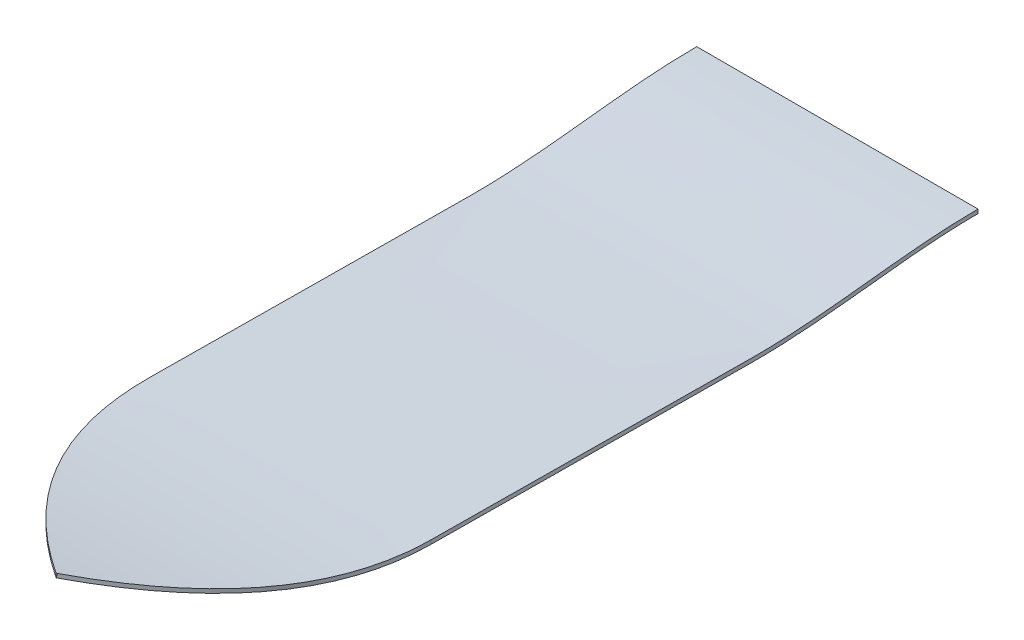
from build123d import *

# Parameters (mm, degrees)
BOSS_EXTRUDE1_DEPTH      = 1524
BOSS_EXTRUDE1_DEPTH_BACK = 1524
CUT_EXTRUDE1_DEPTH       = 2971.334706017
CUT_EXTRUDE1_DEPTH_BACK  = 2971.334706017
SKETCH3_W                = 5731.45735109
SKETCH3_H                = 7343.9774621


with BuildPart() as part:
    # Sketch1 → Boss-Extrude1 (new, two sides: drawn at the far end of the back side and taken through both)
    with BuildSketch(Plane(origin=(0, 0, 0), x_dir=(0, 0, -1), z_dir=(1, 0, 0)).offset(-BOSS_EXTRUDE1_DEPTH_BACK)):
        with BuildLine():
            Line((-2543.983620891, 91.500570068), (-2547.928552887, 66.408788315))
            add(Edge.make_bspline(
                [(-2547.928552887, 66.408788315), (-2542.105684338, 65.493316442), (-2530.46631391, 63.676489066), (-2507.112577211, 60.083503089), (-2477.826048238, 55.675793735), (-2442.516726356, 50.517885926), (-2395.222130959, 43.816594485), (-2335.697444714, 35.769425786), (-2263.618234042, 26.639961703), (-2190.889209569, 18.037515907), (-2093.050791937, 7.270175081), (-1969.128182432, -4.871860435), (-1817.821496687, -17.335536668), (-1663.914846889, -27.692955364), (-1507.408429898, -35.944994341), (-1374.818232478, -41.066683579), (-1267.448528406, -44.113566075), (-1186.263962878, -45.868068288), (-1118.091308787, -46.906724557), (-1063.174332439, -47.440708029), (-1008.358706053, -47.932840303), (-939.802208331, -48.565603467), (-830.132156253, -49.567925143), (-693.037131286, -50.823892641), (-528.525832615, -52.329314041), (-364.013775929, -53.835150797), (-199.501939719, -55.340892605), (-34.990042365, -56.846659346), (129.521840685, -58.352416097), (294.033723774, -59.858171071), (458.545614851, -61.363938356), (595.63886235, -62.618744472), (705.313664164, -63.62295068), (787.570168186, -64.37625734), (856.116870754, -65.003920803), (910.954206669, -65.504801547), (945.226222852, -65.819040387), (969.218546989, -66.035780436), (982.921278871, -66.165679202), (996.724364691, -66.274488824), (1013.862181684, -66.336294882), (1041.169862836, -66.300266795), (1075.035296353, -65.998438619), (1128.694009016, -65.000777719), (1194.815870346, -62.841500309), (1272.789633687, -58.966755677), (1349.536899656, -53.983476183), (1450.427706366, -46.094404041), (1574.211953424, -34.336590519), (1720.214259372, -18.588585689), (1864.875844249, -2.590206527), (1985.316604958, 9.801057862), (2082.212504816, 18.464705862), (2155.309626953, 24.167335273), (2228.986179203, 28.904666927), (2290.994880468, 31.906447902), (2341.047381855, 33.655381718), (2378.827009026, 34.619613478), (2410.533440068, 35.115891624), (2436.026851529, 35.317945116), (2448.844419205, 35.352211204), (2455.244379109, 35.352211204)],
                knots=[0, 0, 0, 0, 0.00390625, 0.0078125, 0.015625, 0.0234375, 0.03125, 0.046875, 0.0625, 0.078125, 0.09375, 0.125, 0.15625, 0.1875, 0.21875, 0.25, 0.265625, 0.28125, 0.296875, 0.3046875, 0.3125, 0.328125, 0.34375, 0.375, 0.40625, 0.4375, 0.46875, 0.5, 0.53125, 0.5625, 0.59375, 0.625, 0.640625, 0.65625, 0.671875, 0.6796875, 0.6875, 0.69140625, 0.693359375, 0.6953125, 0.69921875, 0.703125, 0.7109375, 0.71875, 0.734375, 0.75, 0.765625, 0.78125, 0.8125, 0.84375, 0.875, 0.90625, 0.921875, 0.9375, 0.953125, 0.96875, 0.9765625, 0.984375, 0.9921875, 0.99609375, 1, 1, 1, 1], degree=3))
            Line((2455.244379109, 35.352211204), (2455.244379109, 60.752211204))
            add(Edge.make_bspline(
                [(-2543.983620891, 91.500570068), (-2312.035580769, 55.033680082), (-1972.073883028, 16.227654851), (-1494.655069529, -12.393640456), (-1247.390010346, -19.826032299), (-1100.639201875, -21.676942451), (-1073.239826601, -21.943396342), (-1052.673202444, -22.129495205), (-953.281518673, -23.039959986), (-775.061118852, -24.671851119), (-500.874569462, -27.181392544), (-199.269457953, -29.941962734), (129.754315637, -32.953481324), (431.359432405, -35.71403098), (705.545955512, -38.223675062), (878.627736523, -39.809427698), (972.876611233, -40.6693717), (986.587550391, -40.796468465), (1005.396014769, -40.9270339), (1088.693400392, -41.02208833), (1233.800754896, -36.72664045), (1715.239092527, -3.018390136), (2093.620176364, 60.752211204), (2455.244379109, 60.752211204)],
                knots=[0, 0, 0, 0, 0.15625, 0.21875, 0.2890625, 0.30078125, 0.302734375, 0.3046875, 0.3125, 0.359375, 0.40625, 0.46875, 0.53125, 0.59375, 0.640625, 0.6875, 0.692382812, 0.694335938, 0.6953125, 0.703125, 0.7421875, 0.78125, 1, 1, 1, 1], degree=3))
        make_face()
    extrude(amount=BOSS_EXTRUDE1_DEPTH + BOSS_EXTRUDE1_DEPTH_BACK)

    # Sketch3 → Cut-Extrude1 (cut, two sides: drawn at the far end of the back side and taken through both)
    with BuildSketch(Plane(origin=(0, 0, 0), x_dir=(1, 0, 0), z_dir=(0, 1, 0)).offset(-CUT_EXTRUDE1_DEPTH_BACK)):
        with Locations((889.204947701, -870.266531084)):
            Rectangle(SKETCH3_W, SKETCH3_H)
        with BuildLine():
            Line((-900, 2451.289699984), (900, 2451.289699984))
            Line((900, 2451.289699984), (900, -1047.938300016))
            add(Edge.make_bspline(
                [(900, -1047.938300016), (900, -1922.576905199), (0, -2547.928552887)],
                knots=[0, 0, 0, 1, 1, 1], degree=2))
            add(Edge.make_bspline(
                [(-900, -1047.938300016), (-900, -1922.576905199), (0, -2547.928552887)],
                knots=[0, 0, 0, 1, 1, 1], degree=2))
            Line((-900, -1047.938300016), (-900, 2451.289699984))
        make_face(mode=Mode.SUBTRACT)
    extrude(amount=CUT_EXTRUDE1_DEPTH + CUT_EXTRUDE1_DEPTH_BACK, mode=Mode.SUBTRACT)


solid = part.part
